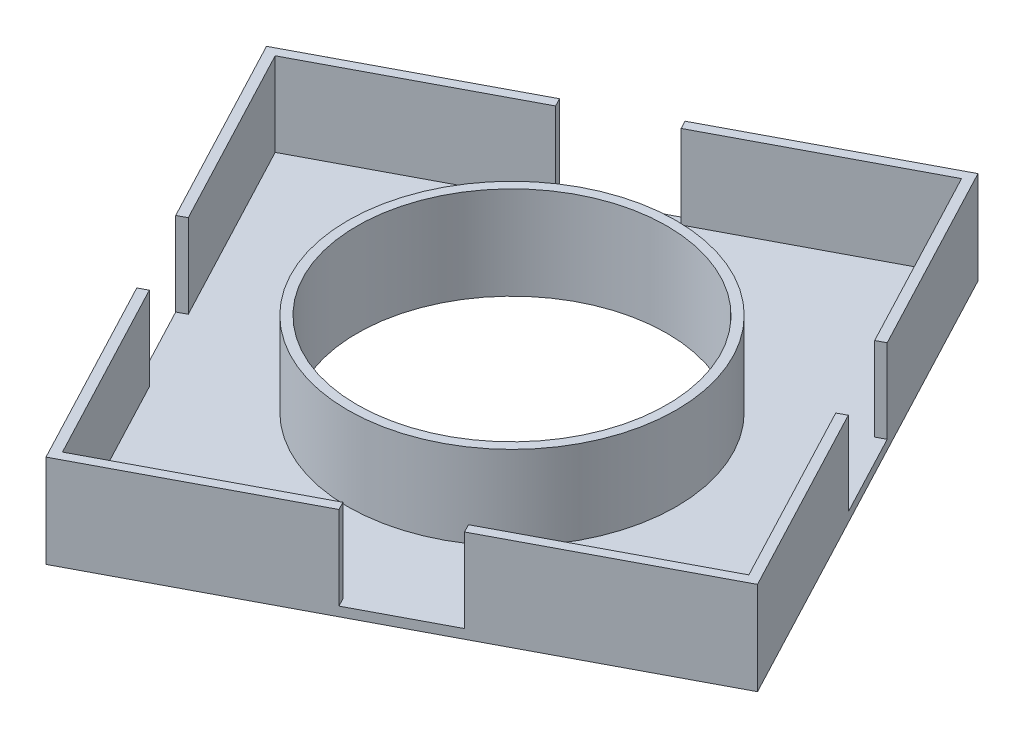
from build123d import *

# Parameters (mm, degrees)
SKETCH2_R           = 50
BOSS_EXTRUDE1_DEPTH = 30
SKETCH6_R           = 2
BOSS_EXTRUDE5_DEPTH = 20
FILLET2_R           = 2
SHELL1_START        = 3
SHELL1_OUTLINE_R    = 53
SHELL1_DEPTH        = 27
CUT_EXTRUDE3_DEPTH  = 27


# Read off the part's stored shape, not the designer's step: Shell1
with BuildPart() as part:
    # Sketch2 → Boss-Extrude1 (new body)
    with BuildSketch(Plane(origin=(0, 0, 0), x_dir=(1, 0, 0), z_dir=(0, 1, 0))):
        Polygon((-35.583006561, -114.820946016), (114.820946016, -35.583006561), (35.583006561, 114.820946016), (-114.820946016, 35.583006561), align=None)
        with Locations(Location((0, 0, 0), (0, 0, 270))):
            Circle(SKETCH2_R, mode=Mode.SUBTRACT)
    extrude(amount=BOSS_EXTRUDE1_DEPTH)

    # Sketch6 → Boss-Extrude5 (add)
    with BuildSketch(Plane(origin=(0, 0, 0), x_dir=(-1, 0, 0), z_dir=(0, -1, 0))):
        with Locations(Location((76.414747812, 23.680927279, 0), (0, 0, 270))):
            Circle(SKETCH6_R)
        with Locations(Location((23.680927279, -76.414747812, 0), (0, 0, 270))):
            Circle(SKETCH6_R)
        with Locations(Location((-76.414747812, -23.680927279, 0), (0, 0, 270))):
            Circle(SKETCH6_R)
        with Locations(Location((-23.680927279, 76.414747812, 0), (0, 0, 270))):
            Circle(SKETCH6_R)
    extrude(amount=BOSS_EXTRUDE5_DEPTH)

    # Fillet2
    fillet2_edges = [part.edges().sort_by_distance(p)[0] for p in [
        (-76.414747812, 0, -25.680927279),
        (-76.414747812, -20, -25.680927279),
        (23.680927279, 0, -78.414747812),
        (23.680927279, -20, -78.414747812),
        (76.414747812, 0, 21.680927279),
        (76.414747812, -20, 21.680927279),
        (-23.680927279, 0, 74.414747812),
        (-23.680927279, -20, 74.414747812),
    ]]
    fillet(fillet2_edges, radius=FILLET2_R)

    # Shell1 outline → Shell1 (cut)
    with BuildSketch(Plane(origin=(0, 0, 0), x_dir=(1, 0, 0), z_dir=(0, 1, 0)).offset(SHELL1_START)):
        Polygon((110.768442039, -34.327135741), (34.327135741, 110.768442039), (-110.768442039, 34.327135741), (-34.327135741, -110.768442039), align=None)
        Circle(SHELL1_OUTLINE_R, mode=Mode.SUBTRACT)
    extrude(amount=SHELL1_DEPTH, mode=Mode.SUBTRACT)

    # Sketch7 → Cut-Extrude3 (cut)
    with BuildSketch(Plane(origin=(0, 30, 0), x_dir=(1, 0, 0), z_dir=(0, 1, 0))):
        Polygon((79.539371783, 24.949716157), (82.193559182, 26.348032736), (68.210393395, 52.88990672), (65.556205997, 51.491590141), align=None)
        Polygon((51.491590141, -65.556205997), (24.949716157, -79.539371783), (26.348032736, -82.193559182), (52.88990672, -68.210393395), align=None)
        Polygon((-65.556205997, -51.491590141), (-79.539371783, -24.949716157), (-82.193559182, -26.348032736), (-68.210393395, -52.88990672), align=None)
        Polygon((-51.491590141, 65.556205997), (-24.949716157, 79.539371783), (-26.348032736, 82.193559182), (-52.88990672, 68.210393395), align=None)
    extrude(amount=-CUT_EXTRUDE3_DEPTH, mode=Mode.SUBTRACT)


solid = part.part
